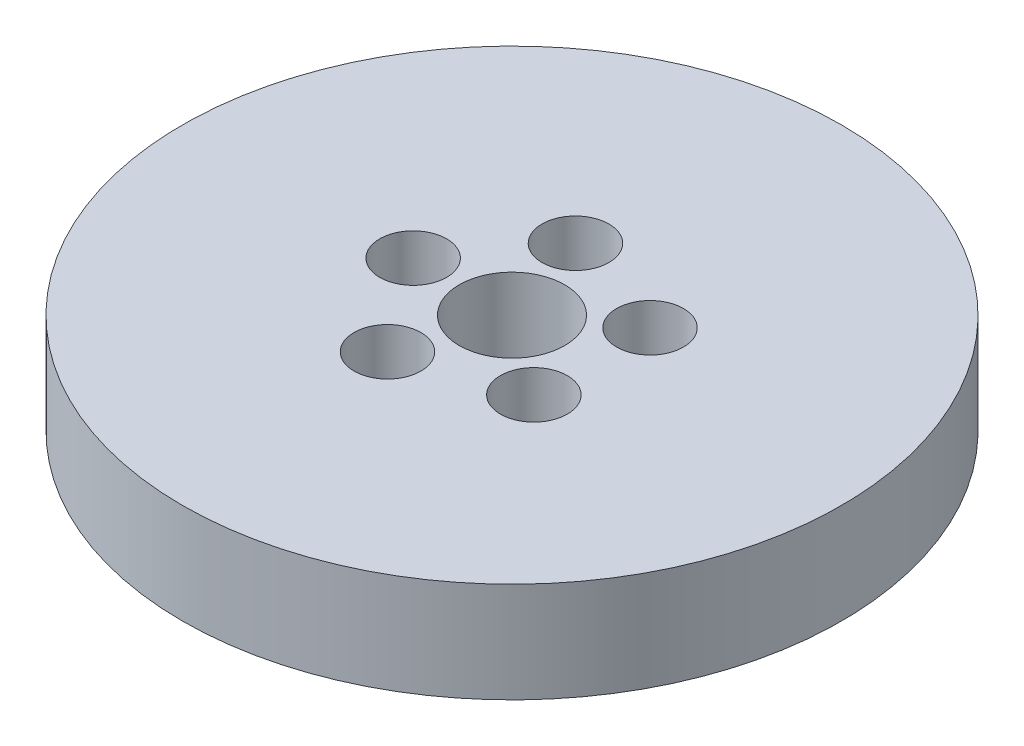
from build123d import *

# Parameters (mm, degrees)
SKETCH1_R           = 62.5
BOSS_EXTRUDE1_DEPTH = 19
SKETCH2_R           = 10
CUT_EXTRUDE1_DEPTH  = 91.407411201
SKETCH3_R           = 6.340359338
CUT_EXTRUDE2_DEPTH  = 14.796108955
CIRPATTERN1_COUNT   = 5


with BuildPart() as part:
    # Sketch1 → Boss-Extrude1 (new body)
    with BuildSketch(Plane(origin=(0, 0, 0), x_dir=(1, 0, 0), z_dir=(0, 1, 0))):
        Circle(SKETCH1_R)
    extrude(amount=BOSS_EXTRUDE1_DEPTH)

    # Sketch2 → Cut-Extrude1 (cut, through all)
    with BuildSketch(Plane(origin=(0, 0, 0), x_dir=(1, 0, 0), z_dir=(0, 1, 0))):
        Circle(SKETCH2_R)
    extrude(amount=CUT_EXTRUDE1_DEPTH, mode=Mode.SUBTRACT)

    # Sketch3 → Cut-Extrude2 (cut)
    with BuildSketch(Plane(origin=(0, 19, 0), x_dir=(1, 0, 0), z_dir=(0, 1, 0))):
        with Locations((-18.743258, 0)):
            Circle(SKETCH3_R)
    cut_extrude2 = extrude(amount=-CUT_EXTRUDE2_DEPTH, mode=Mode.SUBTRACT)

    # CirPattern1: Cut-Extrude2 ×5 about axis
    cirpattern1_axis = Axis((0, 0, 0), (0, 1, 0))
    for i in range(1, CIRPATTERN1_COUNT):
        add(cut_extrude2.rotate(cirpattern1_axis, i * 360 / CIRPATTERN1_COUNT), mode=Mode.SUBTRACT)


solid = part.part
